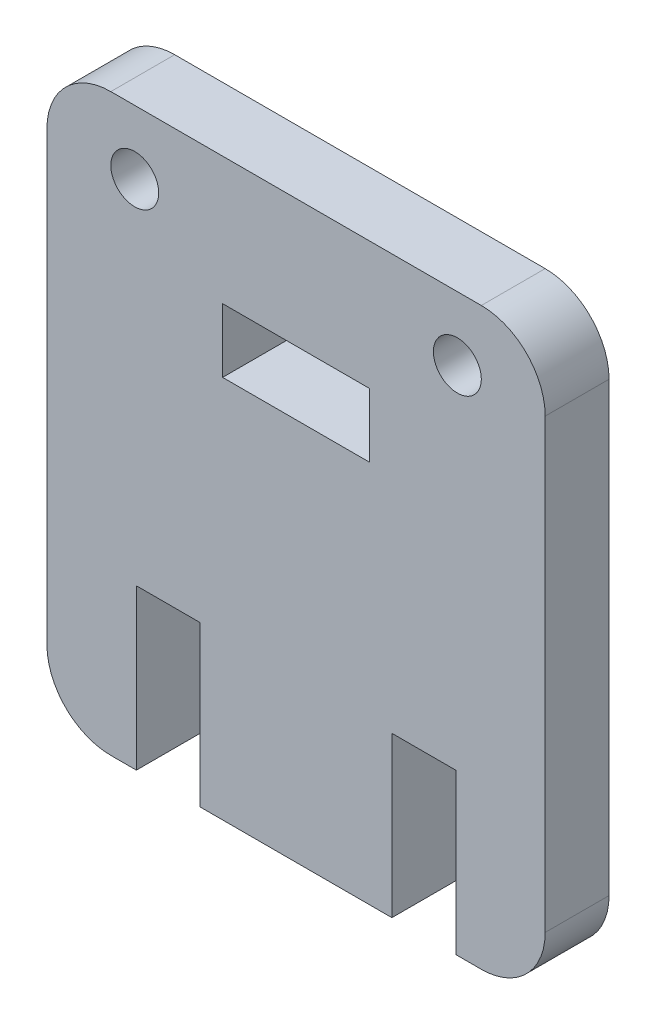
from build123d import *

# Parameters (mm, degrees)
MODEL_R             = 0.75
MODEL_W             = 4.6
MODEL_H             = 2
BOSS_EXTRUDE1_DEPTH = 2


with BuildPart() as part:
    # Model → Boss-Extrude1 (new body)
    with BuildSketch(Plane.XY):
        with BuildLine():
            Line((2, 0), (2.8, 0))
            Line((2.8, 0), (2.8, 5))
            Line((2.8, 5), (4.8, 5))
            Line((4.8, 5), (4.8, 0))
            Line((4.8, 0), (10.8, 0))
            Line((10.8, 0), (10.8, 5))
            Line((10.8, 5), (12.8, 5))
            Line((12.8, 5), (12.8, 0))
            Line((12.8, 0), (13.6, 0))
            ThreePointArc((13.6, 0), (15.014213562, 0.585786438), (15.6, 2))
            Line((15.6, 2), (15.6, 16))
            ThreePointArc((15.6, 16), (15.014213562, 17.414213562), (13.6, 18))
            Line((13.6, 18), (2, 18))
            ThreePointArc((2, 18), (0.585786438, 17.414213562), (0, 16))
            Line((0, 16), (0, 2))
            ThreePointArc((0, 2), (0.585786438, 0.585786438), (2, 0))
        make_face()
        with Locations((2.75, 16)):
            Circle(MODEL_R, mode=Mode.SUBTRACT)
        with Locations((12.85, 16)):
            Circle(MODEL_R, mode=Mode.SUBTRACT)
        with Locations((7.8, 13)):
            Rectangle(MODEL_W, MODEL_H, mode=Mode.SUBTRACT)
    extrude(amount=BOSS_EXTRUDE1_DEPTH)


solid = part.part
